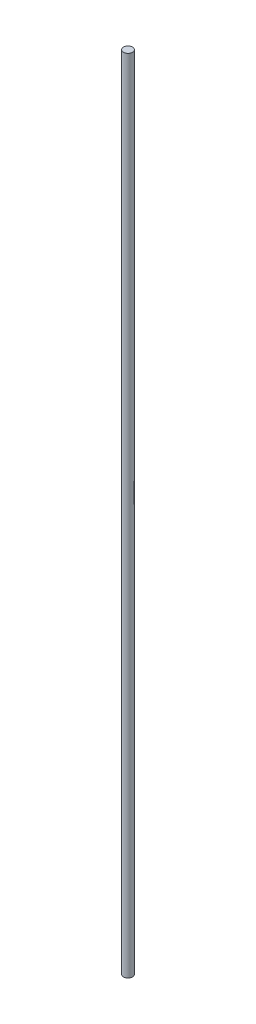
from build123d import *

# Parameters (mm, degrees)
SKETCH1_R           = 5.08
BOSS_EXTRUDE1_DEPTH = 900.684


with BuildPart() as part:
    # Sketch1 → Boss-Extrude1 (new body)
    with BuildSketch(Plane(origin=(0, 0, 0), x_dir=(1, 0, 0), z_dir=(0, 1, 0))):
        Circle(SKETCH1_R)
    extrude(amount=BOSS_EXTRUDE1_DEPTH)


solid = part.part
